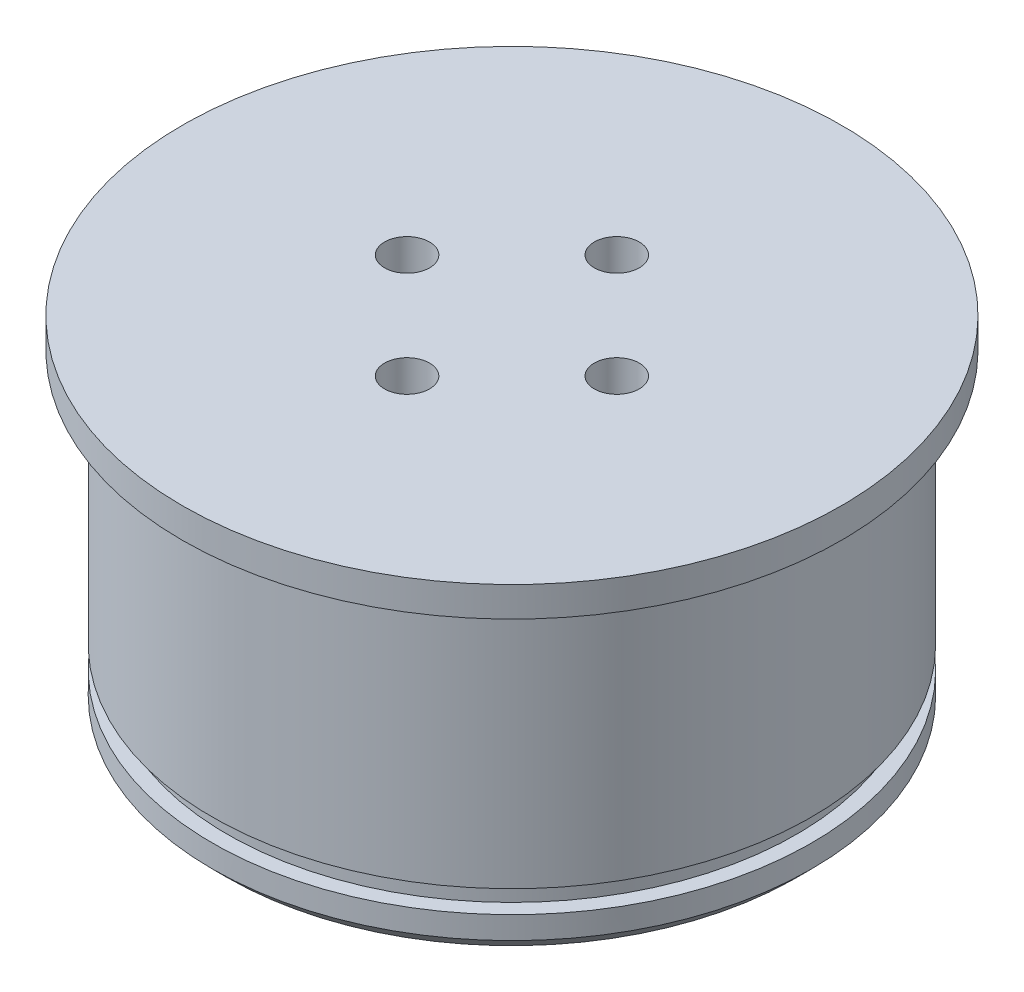
from build123d import *

# Parameters (mm, degrees)
SKETCH_1_R               = 20
EXTRUDE_1_DEPTH          = 21
SKETCH_2_R               = 10
CUT_EXTRUDE_2_DEPTH      = 2.5
SKETCH_5_R               = 20
SKETCH_5_R_2             = 19
CUT_EXTRUDE_5_DEPTH      = 1.5
CHAMFER_1_SIZE           = 1
SKETCH_6_R               = 22
EXTRUDE_2_DEPTH          = 2
SKETCH_4_R               = 1.5
CUT_EXTRUDE_6_DEPTH      = 38.259227045
PATTERN_CIRCULAR_1_COUNT = 4


with BuildPart() as part:
    # Эскиз1 → Бобышка-Вытянуть1 (new body)
    with BuildSketch(Plane(origin=(0, 0, 0), x_dir=(1, 0, 0), z_dir=(0, 1, 0))):
        Circle(SKETCH_1_R)
    extrude(amount=EXTRUDE_1_DEPTH)

    # Эскиз2 → Вырез-Вытянуть2 (cut)
    with BuildSketch(Plane.XZ):
        Circle(SKETCH_2_R)
    extrude(amount=-CUT_EXTRUDE_2_DEPTH, mode=Mode.SUBTRACT)

    # Эскиз5 → Вырез-Вытянуть5 (cut)
    with BuildSketch(Plane(origin=(0, 2.5, 0), x_dir=(-1, 0, 0), z_dir=(0, -1, 0))):
        Circle(SKETCH_5_R)
        Circle(SKETCH_5_R_2, mode=Mode.SUBTRACT)
    extrude(amount=-CUT_EXTRUDE_5_DEPTH, mode=Mode.SUBTRACT)

    # Фаска1
    chamfer_1_edges = [part.edges().sort_by_distance(p)[0] for p in [
        (-20, 0, 0),
    ]]
    chamfer(chamfer_1_edges, length=CHAMFER_1_SIZE)

    # Эскиз6 → Бобышка-Вытянуть2 (add)
    with BuildSketch(Plane(origin=(0, 21, 0), x_dir=(1, 0, 0), z_dir=(0, 1, 0))):
        Circle(SKETCH_6_R)
    extrude(amount=EXTRUDE_2_DEPTH)

    # Эскиз4 → Вырез-Вытянуть6 (cut, through all)
    with BuildSketch(Plane.XZ.offset(-2.5)):
        with Locations((0, 7)):
            Circle(SKETCH_4_R)
    cut_extrude_6 = extrude(amount=-CUT_EXTRUDE_6_DEPTH, mode=Mode.SUBTRACT)

    # Круговой массив1: Вырез-Вытянуть6 ×4 about axis
    pattern_circular_1_axis = Axis((0, 2.5, 0), (0, -1, 0))
    for i in range(1, PATTERN_CIRCULAR_1_COUNT):
        add(cut_extrude_6.rotate(pattern_circular_1_axis, i * 360 / PATTERN_CIRCULAR_1_COUNT), mode=Mode.SUBTRACT)


solid = part.part
